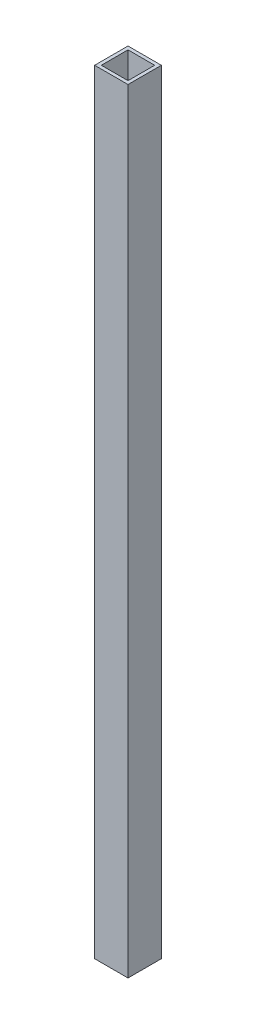
from build123d import *

# Parameters (mm, degrees)
SKETCH1_W           = 15
SKETCH1_H           = 15
SKETCH1_W_2         = 12
SKETCH1_H_2         = 12
EXTRUDE_THIN1_DEPTH = 348


with BuildPart() as part:
    # Sketch1 → Extrude-Thin1 (new body)
    with BuildSketch(Plane(origin=(0, 0, 0), x_dir=(1, 0, 0), z_dir=(0, 1, 0))):
        with Locations((7.5, 7.5)):
            Rectangle(SKETCH1_W, SKETCH1_H)
        with Locations((7.5, 7.5)):
            Rectangle(SKETCH1_W_2, SKETCH1_H_2, mode=Mode.SUBTRACT)
    extrude(amount=EXTRUDE_THIN1_DEPTH)


solid = part.part
